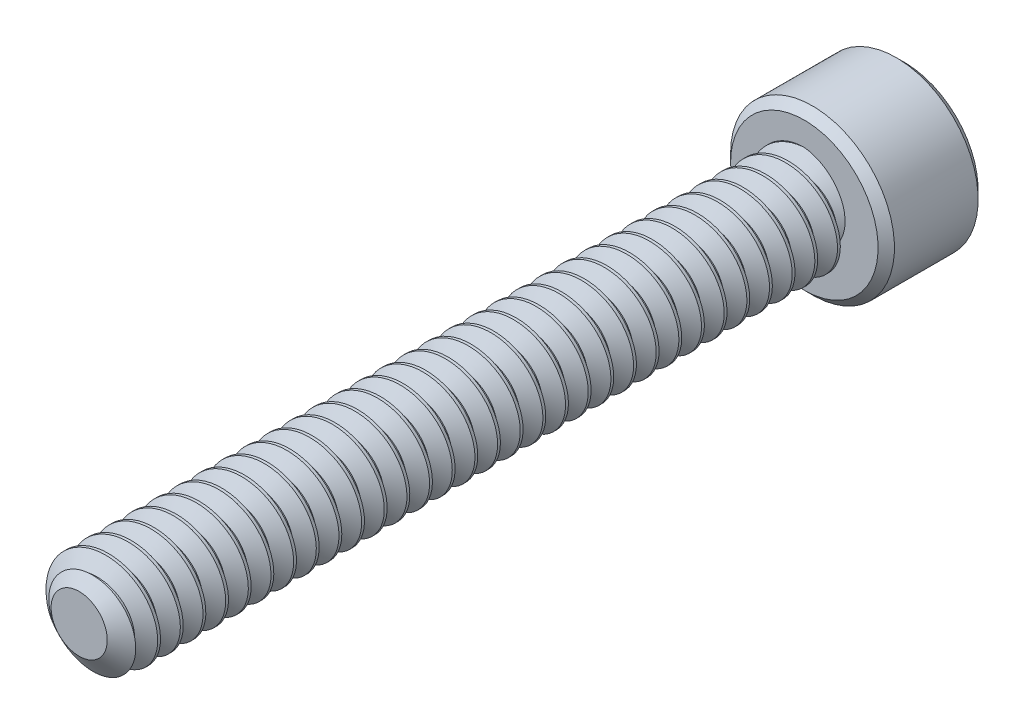
from build123d import *

# Parameters (mm, degrees)
SKETCH1_R          = 1.7526
EXTRUDE1_DEPTH     = 25.4
CUT_SWEEP1_PITCH   = 0.79375
SKETCH6_R          = 2.8702
EXTRUDE2_DEPTH     = 3.5052
CUT_EXTRUDE1_DEPTH = 2.08359375
CHAMFER1_SIZE      = 0.28702


with BuildPart() as part:
    # Sketch1 → Extrude1 (new body)
    with BuildSketch(Plane.XY):
        Circle(SKETCH1_R)
    extrude(amount=-EXTRUDE1_DEPTH)

    # Cut-Sweep1: arcs per turn and ends read off the stored shape
    # Cut-Sweep1: the profile of Sketch3 profile screwed along a right-hand helix through 35 turns, 6 arcs to a turn; built about Z, then put on its axis
    cut_sweep1_z = Axis((0, 0, 0), (0, 0, 1))
    cut_sweep1_corners = [(1.7529, 0, -1.488454455), (1.237044252, 0, -1.190625), (1.237044252, 0, -1.09140625), (1.7529, 0, -0.793576795)]
    with BuildLine(mode=Mode.PRIVATE) as cut_sweep1_profile:
        Line(cut_sweep1_corners[0], cut_sweep1_corners[1])
        Line(cut_sweep1_corners[1], cut_sweep1_corners[2])
        Line(cut_sweep1_corners[2], cut_sweep1_corners[3])
        Line(cut_sweep1_corners[3], cut_sweep1_corners[0])
    cut_sweep1_cap = Face(cut_sweep1_profile.wire())
    cut_sweep1_turn_angles = [0, 30, 60, 90, 120, 150, 180, 210, 240, 270, 300, 330, 360]
    cut_sweep1_turn_weights = [1, 0.8660254037844387, 1, 0.8660254037844387, 1, 0.8660254037844387, 1, 0.8660254037844387, 1, 0.8660254037844387, 1, 0.8660254037844387, 1]
    cut_sweep1_turn_rails = [Edge.make_bspline([Vector(p[0], p[1], 0).rotate(cut_sweep1_z, cut_sweep1_turn_angles[k]) / cut_sweep1_turn_weights[k] + Vector(0, 0, p[2] + CUT_SWEEP1_PITCH * cut_sweep1_turn_angles[k] / 360) for k in range(13)], [0, 0, 0, 1, 1, 2, 2, 3, 3, 4, 4, 5, 5, 6, 6, 6], 2, cut_sweep1_turn_weights) for p in cut_sweep1_corners]
    cut_sweep1_turn_sides = [Face.make_surface_from_curves(cut_sweep1_turn_rails[p[0]], cut_sweep1_turn_rails[p[1]]) for p in [(0, 1), (1, 2), (2, 3), (3, 0)]]
    cut_sweep1 = Plane(origin=(0, 0, 0), x_dir=(0, 1, 0), z_dir=(0, 0, -1)) * Solid(Shell([*[p.moved(Location((0, 0, CUT_SWEEP1_PITCH * i))) for i in range(35) for p in cut_sweep1_turn_sides], cut_sweep1_cap, cut_sweep1_cap.rotate(cut_sweep1_z, 12600).moved(Location((0, 0, CUT_SWEEP1_PITCH * 12600 / 360)))]))
    add(cut_sweep1, mode=Mode.SUBTRACT)

    # Sketch4 → Cut-Revolve1 (revolve, cut)
    with BuildSketch(Plane(origin=(0, 0, 0), x_dir=(0, 0, -1), z_dir=(1, 0, 0)), mode=Mode.PRIVATE) as cut_revolve1_sk:
        Polygon((0.538848736, 1.7526), (0, 0.983044252), (0, 1.7526), align=None)
    revolve(cut_revolve1_sk.sketch.rotate(Axis((0, 0, 0), (0, 0, -1)), 261.048315518), axis=Axis((0, 0, 0), (0, 0, -1)), mode=Mode.SUBTRACT)

    # Sketch6 → Extrude2 (add)
    with BuildSketch(Plane(origin=(0, 0, -25.4), x_dir=(-1, 0, 0), z_dir=(0, 0, -1))):
        Circle(SKETCH6_R)
    extrude(amount=EXTRUDE2_DEPTH)

    # Sketch7 → Cut-Extrude1 (cut)
    with BuildSketch(Plane(origin=(0, 0, -28.9052), x_dir=(-1, 0, 0), z_dir=(0, 0, -1))):
        Polygon((0, 1.603951217), (-1.3890625, 0.801975608), (-1.3890625, -0.801975608), (0, -1.603951217), (1.3890625, -0.801975608), (1.3890625, 0.801975608), align=None)
    extrude(amount=-CUT_EXTRUDE1_DEPTH, mode=Mode.SUBTRACT)

    # Cut-Extrude2 cone 1 section (through the dimple's axis) → Cut-Extrude2 (revolve, cut)
    with BuildSketch(Plane(origin=(0, 0, -28.9052), x_dir=(0, 1, 0), z_dir=(1, 0, 0))):
        Polygon((0, 0), (1.603951217, 0), (0, 1.603951217), align=None)
    revolve(axis=Axis((0, 0, -28.9052), (0, 0, 1)), mode=Mode.SUBTRACT)

    # Chamfer1
    chamfer1_edges = [part.edges().sort_by_distance(p)[0] for p in [
        (2.8702, 0, -25.4),
        (2.8702, 0, -28.9052),
    ]]
    chamfer(chamfer1_edges, length=CHAMFER1_SIZE)


solid = part.part
